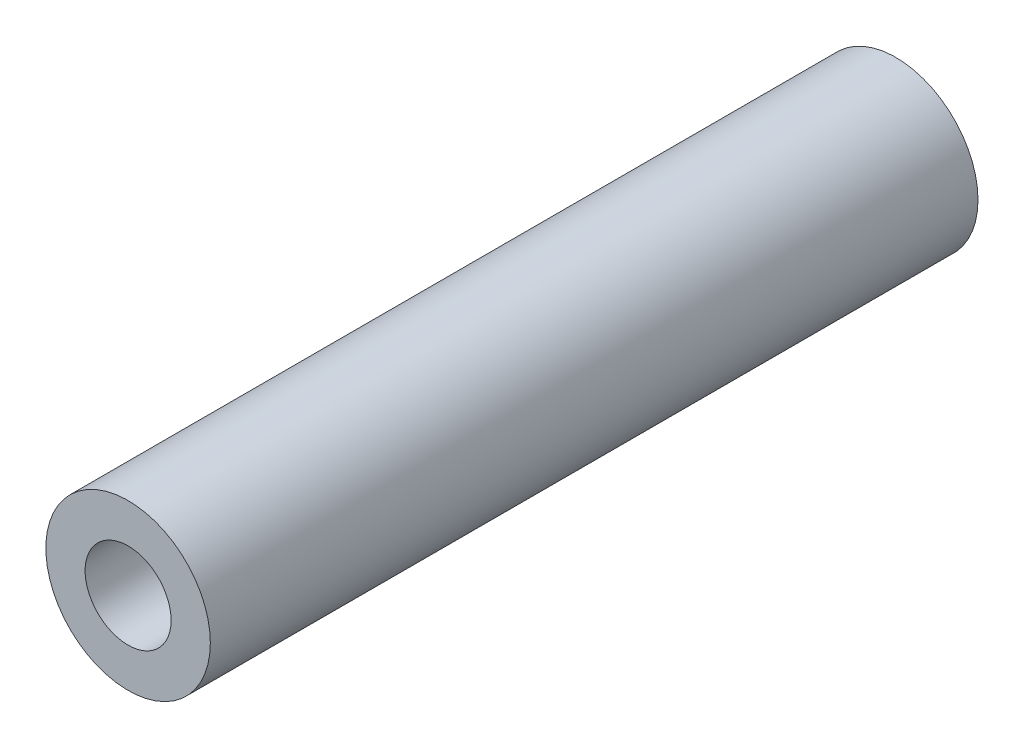
from build123d import *

# Parameters (mm, degrees)
SKETCH1_R           = 4.7625
SKETCH1_R_2         = 2.4892
BOSS_EXTRUDE1_DEPTH = 44.45


with BuildPart() as part:
    # Sketch1 → Boss-Extrude1 (new body)
    with BuildSketch(Plane.XY):
        Circle(SKETCH1_R)
        Circle(SKETCH1_R_2, mode=Mode.SUBTRACT)
    extrude(amount=BOSS_EXTRUDE1_DEPTH)


solid = part.part
